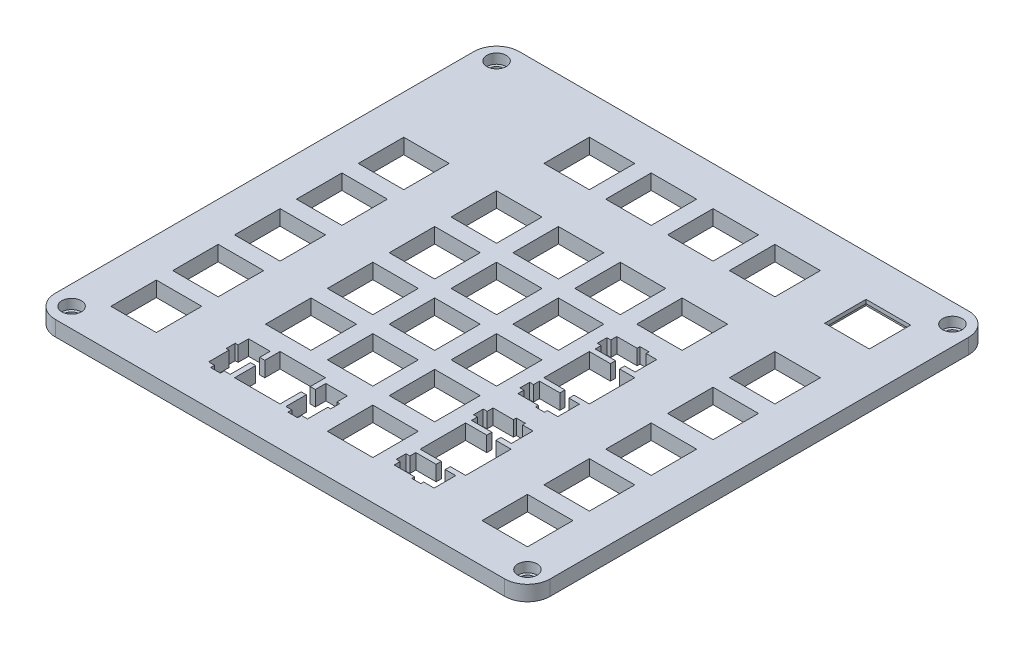
from build123d import *

# Parameters (mm, degrees)
SKETCH6_R               = 2.15
SKETCH6_W               = 14
SKETCH6_H               = 14
SKETCH6_R_2             = 2
BOSS_EXTRUDE1_DEPTH     = 4.68
CUT_EXTRUDE1_DEPTH      = 209.941263038
CUT_EXTRUDE1_DEPTH_BACK = 209.941263038
SKETCH15_W              = 13.75
SKETCH15_H              = 12.75
CUT_EXTRUDE2_DEPTH      = 2
SKETCH17_R              = 3
CUT_EXTRUDE3_DEPTH      = 3
SKETCH19_W              = 19.75
SKETCH19_H              = 18.75
CUT_EXTRUDE5_DEPTH      = 3.5
SKETCH18_W              = 10.14
SKETCH18_H              = 8.43
CUT_EXTRUDE4_DEPTH      = 2


with BuildPart() as part:
    # Sketch6 → Boss-Extrude1 (new body)
    with BuildSketch(Plane(origin=(0, 0, 0), x_dir=(1, 0, 0), z_dir=(0, 1, 0))):
        with BuildLine():
            ThreePointArc((0, 7), (2.050252532, 2.050252532), (7, 0))
            Line((7, 0), (145.39, 0))
            ThreePointArc((145.39, 0), (150.339747468, 2.050252532), (152.39, 7))
            Line((152.39, 7), (152.39, 135.87))
            ThreePointArc((152.39, 135.87), (150.339747468, 140.819747468), (145.39, 142.87))
            Line((145.39, 142.87), (7, 142.87))
            ThreePointArc((7, 142.87), (2.050252532, 140.819747468), (0, 135.87))
            Line((0, 135.87), (0, 7))
        make_face()
        with Locations((5.995, 5.995)):
            Circle(SKETCH6_R, mode=Mode.SUBTRACT)
        with Locations((19.045, 19.05)):
            Rectangle(SKETCH6_W, SKETCH6_H, mode=Mode.SUBTRACT)
        Polygon((48.57, 12.28), (46.745, 12.28), (46.745, 11.08), (43.745, 11.08), (43.745, 12.28), (41.92, 12.28), (41.92, 18.55), (41.045, 18.55), (41.045, 21.35), (41.92, 21.35), (41.92, 24.58), (48.57, 24.58), (48.57, 21.35), (50.145, 21.35), (50.145, 26.05), (64.145, 26.05), (64.145, 21.35), (65.72, 21.35), (65.72, 24.58), (72.37, 24.58), (72.37, 21.35), (73.245, 21.35), (73.245, 18.55), (72.37, 18.55), (72.37, 12.28), (70.545, 12.28), (70.545, 11.08), (67.545, 11.08), (67.545, 12.28), (65.72, 12.28), (65.72, 18.55), (64.145, 18.55), (64.145, 12.05), (50.145, 12.05), (50.145, 18.55), (48.57, 18.55), align=None, mode=Mode.SUBTRACT)
        with Locations((19.045, 38.1)):
            Rectangle(SKETCH6_W, SKETCH6_H, mode=Mode.SUBTRACT)
        with Locations((19.045, 57.15)):
            Rectangle(SKETCH6_W, SKETCH6_H, mode=Mode.SUBTRACT)
        with Locations((47.62, 38.1)):
            Rectangle(SKETCH6_W, SKETCH6_H, mode=Mode.SUBTRACT)
        with Locations((66.67, 38.1)):
            Rectangle(SKETCH6_W, SKETCH6_H, mode=Mode.SUBTRACT)
        with Locations((47.62, 57.15)):
            Rectangle(SKETCH6_W, SKETCH6_H, mode=Mode.SUBTRACT)
        with Locations((66.67, 57.15)):
            Rectangle(SKETCH6_W, SKETCH6_H, mode=Mode.SUBTRACT)
        with Locations((85.72, 19.05)):
            Rectangle(SKETCH6_W, SKETCH6_H, mode=Mode.SUBTRACT)
        Polygon((98, 37.15), (98, 38.975), (96.8, 38.975), (96.8, 41.975), (98, 41.975), (98, 43.8), (104.27, 43.8), (104.27, 44.675), (107.07, 44.675), (107.07, 43.8), (110.3, 43.8), (110.3, 37.15), (107.07, 37.15), (107.07, 35.575), (111.77, 35.575), (111.77, 21.575), (107.07, 21.575), (107.07, 20), (110.3, 20), (110.3, 13.35), (107.07, 13.35), (107.07, 12.475), (104.27, 12.475), (104.27, 13.35), (98, 13.35), (98, 15.175), (96.8, 15.175), (96.8, 18.175), (98, 18.175), (98, 20), (104.27, 20), (104.27, 21.575), (97.77, 21.575), (97.77, 35.575), (104.27, 35.575), (104.27, 37.15), align=None, mode=Mode.SUBTRACT)
        with Locations((146.395, 5.995)):
            Circle(SKETCH6_R, mode=Mode.SUBTRACT)
        with Locations((133.345, 19.05)):
            Rectangle(SKETCH6_W, SKETCH6_H, mode=Mode.SUBTRACT)
        with Locations((85.72, 38.1)):
            Rectangle(SKETCH6_W, SKETCH6_H, mode=Mode.SUBTRACT)
        with Locations((85.72, 57.15)):
            Rectangle(SKETCH6_W, SKETCH6_H, mode=Mode.SUBTRACT)
        Polygon((98, 75.25), (98, 77.075), (96.8, 77.075), (96.8, 80.075), (98, 80.075), (98, 81.9), (104.27, 81.9), (104.27, 82.775), (107.07, 82.775), (107.07, 81.9), (110.3, 81.9), (110.3, 75.25), (107.07, 75.25), (107.07, 73.675), (111.77, 73.675), (111.77, 59.675), (107.07, 59.675), (107.07, 58.1), (110.3, 58.1), (110.3, 51.45), (107.07, 51.45), (107.07, 50.575), (104.27, 50.575), (104.27, 51.45), (98, 51.45), (98, 53.275), (96.8, 53.275), (96.8, 56.275), (98, 56.275), (98, 58.1), (104.27, 58.1), (104.27, 59.675), (97.77, 59.675), (97.77, 73.675), (104.27, 73.675), (104.27, 75.25), align=None, mode=Mode.SUBTRACT)
        with Locations((133.345, 38.1)):
            Rectangle(SKETCH6_W, SKETCH6_H, mode=Mode.SUBTRACT)
        with Locations((133.345, 57.15)):
            Rectangle(SKETCH6_W, SKETCH6_H, mode=Mode.SUBTRACT)
        with Locations((19.045, 76.2)):
            Rectangle(SKETCH6_W, SKETCH6_H, mode=Mode.SUBTRACT)
        with Locations((19.045, 95.25)):
            Rectangle(SKETCH6_W, SKETCH6_H, mode=Mode.SUBTRACT)
        with Locations((47.62, 76.2)):
            Rectangle(SKETCH6_W, SKETCH6_H, mode=Mode.SUBTRACT)
        with Locations((66.67, 76.2)):
            Rectangle(SKETCH6_W, SKETCH6_H, mode=Mode.SUBTRACT)
        with Locations((47.62, 95.25)):
            Rectangle(SKETCH6_W, SKETCH6_H, mode=Mode.SUBTRACT)
        with Locations((66.67, 95.25)):
            Rectangle(SKETCH6_W, SKETCH6_H, mode=Mode.SUBTRACT)
        with Locations((5.995, 136.875)):
            Circle(SKETCH6_R, mode=Mode.SUBTRACT)
        with Locations((47.62, 123.825)):
            Rectangle(SKETCH6_W, SKETCH6_H, mode=Mode.SUBTRACT)
        with Locations((66.67, 123.825)):
            Rectangle(SKETCH6_W, SKETCH6_H, mode=Mode.SUBTRACT)
        with Locations((85.72, 76.2)):
            Rectangle(SKETCH6_W, SKETCH6_H, mode=Mode.SUBTRACT)
        with Locations((85.72, 95.25)):
            Rectangle(SKETCH6_W, SKETCH6_H, mode=Mode.SUBTRACT)
        with Locations((104.77, 95.25)):
            Rectangle(SKETCH6_W, SKETCH6_H, mode=Mode.SUBTRACT)
        with Locations((133.345, 76.2)):
            Rectangle(SKETCH6_W, SKETCH6_H, mode=Mode.SUBTRACT)
        with Locations((133.345, 95.25)):
            Rectangle(SKETCH6_W, SKETCH6_H, mode=Mode.SUBTRACT)
        with Locations((85.72, 123.825)):
            Rectangle(SKETCH6_W, SKETCH6_H, mode=Mode.SUBTRACT)
        with Locations((104.77, 123.825)):
            Rectangle(SKETCH6_W, SKETCH6_H, mode=Mode.SUBTRACT)
        with Locations((133.34, 123.82)):
            Circle(SKETCH6_R_2, mode=Mode.SUBTRACT)
        with Locations((146.395, 136.875)):
            Circle(SKETCH6_R, mode=Mode.SUBTRACT)
    extrude(amount=BOSS_EXTRUDE1_DEPTH)

    # Sketch15 → Cut-Extrude1 (cut, two sides: drawn at the far end of the back side and taken through both)
    with BuildSketch(Plane(origin=(0, 4.68, 0), x_dir=(1, 0, 0), z_dir=(0, 1, 0)).offset(-CUT_EXTRUDE1_DEPTH_BACK)):
        with Locations((133.34, 123.82)):
            Rectangle(SKETCH15_W, SKETCH15_H)
    extrude(amount=CUT_EXTRUDE1_DEPTH + CUT_EXTRUDE1_DEPTH_BACK, mode=Mode.SUBTRACT)

    # Sketch16 → Cut-Extrude2 (cut)
    with BuildSketch(Plane.XZ):
        with BuildLine():
            Line((17.9, -119.58), (17.9, -123.58))
            ThreePointArc((17.9, -123.58), (11.45, -130.03), (5, -123.58))
            Line((5, -123.58), (5, -119.58))
            ThreePointArc((5, -119.58), (11.45, -113.13), (17.9, -119.58))
        make_face()
    extrude(amount=-CUT_EXTRUDE2_DEPTH, mode=Mode.SUBTRACT)

    # Sketch17 → Cut-Extrude3 (cut)
    with BuildSketch(Plane(origin=(0, 4.68, 0), x_dir=(1, 0, 0), z_dir=(0, 1, 0))):
        with Locations((5.995, 136.875)):
            Circle(SKETCH17_R)
        with Locations((146.395, 136.875)):
            Circle(SKETCH17_R)
        with Locations((146.395, 5.995)):
            Circle(SKETCH17_R)
        with Locations((5.995, 5.995)):
            Circle(SKETCH17_R)
    extrude(amount=-CUT_EXTRUDE3_DEPTH, mode=Mode.SUBTRACT)

    # Sketch19 → Cut-Extrude5 (cut)
    with BuildSketch(Plane.XZ):
        with Locations((133.34, -123.82)):
            Rectangle(SKETCH19_W, SKETCH19_H)
    extrude(amount=-CUT_EXTRUDE5_DEPTH, mode=Mode.SUBTRACT)

    # Sketch18 → Cut-Extrude4 (cut)
    with BuildSketch(Plane.XZ):
        with Locations((33.93, -138.655)):
            Rectangle(SKETCH18_W, SKETCH18_H)
    extrude(amount=-CUT_EXTRUDE4_DEPTH, mode=Mode.SUBTRACT)


solid = part.part
